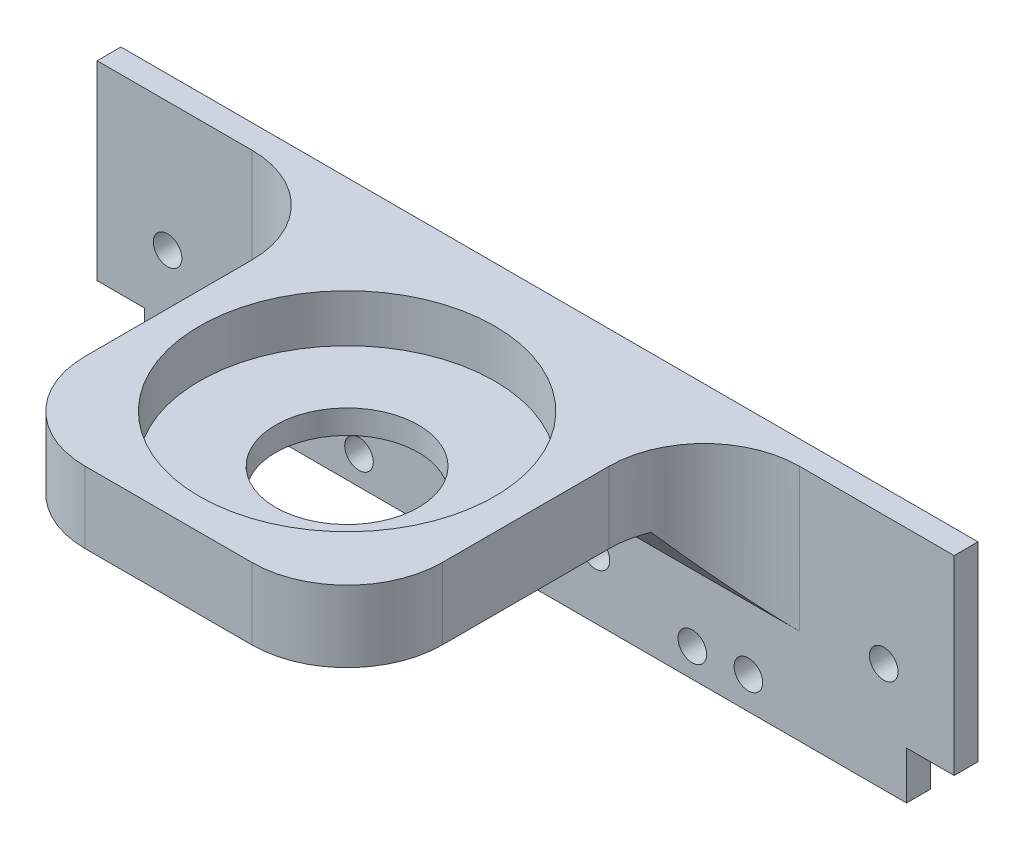
from build123d import *

# Parameters (mm, degrees)
ESQUISSE1_W             = 180
ESQUISSE1_H             = 50
ESQUISSE1_R             = 3
BOSS_EXTRU_1_DEPTH      = 5
ESQUISSE2_W             = 75
ESQUISSE2_H             = 15
BOSS_EXTRU_2_DEPTH      = 75
ESQUISSE3_R             = 15
ENL_V_MAT_EXTRU_1_DEPTH = 15
ESQUISSE4_R             = 31
ENL_V_MAT_EXTRU_2_DEPTH = 10
CONG_1_R                = 20
CHANFREIN1_SIZE         = 15
CHANFREIN1_SIZE2        = 12.586494468
CONG_2_R                = 20
ESQUISSE5_W             = 10
ESQUISSE5_H             = 10
ENL_V_MAT_EXTRU_3_DEPTH = 5


with BuildPart() as part:
    # Esquisse1 → Boss.-Extru.1 (new body)
    with BuildSketch(Plane.XY):
        with Locations((5.796013405, 25)):
            Rectangle(ESQUISSE1_W, ESQUISSE1_H)
        with Locations((40.796013405, 6)):
            Circle(ESQUISSE1_R, mode=Mode.SUBTRACT)
        with Locations((-69.406004871, 22.939397164)):
            Circle(ESQUISSE1_R, mode=Mode.SUBTRACT)
        with Locations((-40.981469067, 6.77616521)):
            Circle(ESQUISSE1_R, mode=Mode.SUBTRACT)
        with Locations((-8.861542866, 12.901085106)):
            Circle(ESQUISSE1_R, mode=Mode.SUBTRACT)
        with Locations(Location((-29.203986595, 6, 0), (0, 0, 180))):
            Circle(ESQUISSE1_R, mode=Mode.SUBTRACT)
        with Locations(Location((80.99803168, 22.939397164, 0), (0, 0, 180))):
            Circle(ESQUISSE1_R, mode=Mode.SUBTRACT)
        with Locations(Location((52.573495876, 6.77616521, 0), (0, 0, 180))):
            Circle(ESQUISSE1_R, mode=Mode.SUBTRACT)
        with Locations(Location((20.453569676, 12.901085106, 0), (0, 0, 180))):
            Circle(ESQUISSE1_R, mode=Mode.SUBTRACT)
    extrude(amount=BOSS_EXTRU_1_DEPTH)

    # Esquisse2 → Boss.-Extru.2 (add)
    with BuildSketch(Plane.XY.offset(5)):
        with Locations((5.796013405, 42.5)):
            Rectangle(ESQUISSE2_W, ESQUISSE2_H)
    extrude(amount=BOSS_EXTRU_2_DEPTH)

    # Esquisse3 → Enlèv. mat.-Extru.1 (cut)
    with BuildSketch(Plane(origin=(0, 50, 0), x_dir=(1, 0, 0), z_dir=(0, 1, 0))):
        with Locations(Location((5.796013405, -42.5, 0), (0, 0, 270))):
            Circle(ESQUISSE3_R)
    extrude(amount=-ENL_V_MAT_EXTRU_1_DEPTH, mode=Mode.SUBTRACT)

    # Esquisse4 → Enlèv. mat.-Extru.2 (cut)
    with BuildSketch(Plane(origin=(0, 50, 0), x_dir=(1, 0, 0), z_dir=(0, 1, 0))):
        with Locations(Location((5.796013405, -42.5, 0), (0, 0, 270))):
            Circle(ESQUISSE4_R)
    extrude(amount=-ENL_V_MAT_EXTRU_2_DEPTH, mode=Mode.SUBTRACT)

    # Congé1
    cong_1_edges = [part.edges().sort_by_distance(p)[0] for p in [
        (43.296013405, 42.5, 80),
        (-31.703986595, 42.5, 80),
    ]]
    fillet(cong_1_edges, radius=CONG_1_R)

    # Chanfrein1
    chanfrein1_edges = [part.edges().sort_by_distance(p)[0] for p in [
        (5.796013405, 35, 5),
    ]]
    chanfrein1_side = [part.faces().sort_by_distance(p)[0] for p in [
        (5.796013405, 22.805952806, 5),
    ]]
    chamfer(chanfrein1_edges, length=CHANFREIN1_SIZE, length2=CHANFREIN1_SIZE2, reference=chanfrein1_side[0])

    # Congé2
    # the kernel refuses this fillet: 20 mm, written as the material it adds along each edge
    with BuildSketch(Plane(origin=(-31.703986595, -30, 5), x_dir=(0, 0, 1), z_dir=(0, 1, 0))) as cong_2_piece_1_section:
        with BuildLine():
            CenterArc((CONG_2_R, -CONG_2_R), CONG_2_R, 90, 90)
            Line((0, -CONG_2_R), (0, 0))
            Line((0, 0), (CONG_2_R, 0))
        make_face()
    cong_2_piece_1 = extrude(amount=80, mode=Mode.PRIVATE)
    cong_2_piece_1 = split(cong_2_piece_1, bisect_by=Plane(origin=(-37.472324852, 26.525505275, 10.475549069), z_dir=(0, 0.6427876096865406, -0.766044443118977)), keep=Keep.TOP, mode=Mode.PRIVATE)
    cong_2_piece_1 = split(cong_2_piece_1, bisect_by=Plane(origin=(-37.472324852, 35, 7.522714945), z_dir=(0, -1, 0)), keep=Keep.TOP, mode=Mode.PRIVATE)
    add(cong_2_piece_1)
    with BuildSketch(Plane(origin=(-31.703986595, -30, 5), x_dir=(0, 0, 1), z_dir=(0, 1, 0))) as cong_2_piece_2_section:
        with BuildLine():
            CenterArc((CONG_2_R, -CONG_2_R), CONG_2_R, 90, 90)
            Line((0, -CONG_2_R), (0, 0))
            Line((0, 0), (CONG_2_R, 0))
        make_face()
    cong_2_piece_2 = extrude(amount=80, mode=Mode.PRIVATE)
    cong_2_piece_2 = split(cong_2_piece_2, bisect_by=Plane(origin=(-31.680860217, 38.546515029, 20.562373921), z_dir=(0, -0.6427876096865406, 0.766044443118977)), keep=Keep.TOP, mode=Mode.PRIVATE)
    cong_2_piece_2 = split(cong_2_piece_2, bisect_by=Plane(origin=(-31.680860217, 35, 21.798113742), z_dir=(0, 1, 0)), keep=Keep.TOP, mode=Mode.PRIVATE)
    add(cong_2_piece_2)
    with BuildSketch(Plane(origin=(-31.703986595, -30, 5), x_dir=(0, 0, 1), z_dir=(0, 1, 0))) as cong_2_piece_3_section:
        with BuildLine():
            CenterArc((CONG_2_R, -CONG_2_R), CONG_2_R, 90, 90)
            Line((0, -CONG_2_R), (0, 0))
            Line((0, 0), (CONG_2_R, 0))
        make_face()
    cong_2_piece_3 = extrude(amount=80, mode=Mode.PRIVATE)
    cong_2_piece_3 = split(cong_2_piece_3, bisect_by=Plane(origin=(-36.294325359, 35.39038505, 17.914066419), z_dir=(0, 0.6427876096865406, -0.766044443118977)), keep=Keep.TOP, mode=Mode.PRIVATE)
    cong_2_piece_3 = split(cong_2_piece_3, bisect_by=Plane(origin=(-36.294325359, 35, 9.359564784), z_dir=(0, 1, 0)), keep=Keep.TOP, mode=Mode.PRIVATE)
    add(cong_2_piece_3)
    with BuildSketch(Plane(origin=(43.296013405, -30, 5), x_dir=(0, 0, 1), z_dir=(0, 1, 0))) as cong_2_piece_4_section:
        with BuildLine():
            CenterArc((CONG_2_R, CONG_2_R), CONG_2_R, 180, 90)
            Line((0, CONG_2_R), (0, 0))
            Line((0, 0), (CONG_2_R, 0))
        make_face()
    cong_2_piece_4 = extrude(amount=80, mode=Mode.PRIVATE)
    cong_2_piece_4 = split(cong_2_piece_4, bisect_by=Plane(origin=(49.064351662, 35, 7.522714945), z_dir=(0, -1, 0)), keep=Keep.TOP, mode=Mode.PRIVATE)
    cong_2_piece_4 = split(cong_2_piece_4, bisect_by=Plane(origin=(49.064351662, 26.525505275, 10.475549069), z_dir=(0, 0.6427876096865406, -0.766044443118977)), keep=Keep.TOP, mode=Mode.PRIVATE)
    add(cong_2_piece_4)
    with BuildSketch(Plane(origin=(43.296013405, -30, 5), x_dir=(0, 0, 1), z_dir=(0, 1, 0))) as cong_2_piece_5_section:
        with BuildLine():
            CenterArc((CONG_2_R, CONG_2_R), CONG_2_R, 180, 90)
            Line((0, CONG_2_R), (0, 0))
            Line((0, 0), (CONG_2_R, 0))
        make_face()
    cong_2_piece_5 = extrude(amount=80, mode=Mode.PRIVATE)
    cong_2_piece_5 = split(cong_2_piece_5, bisect_by=Plane(origin=(43.272887026, 35, 21.798113742), z_dir=(0, 1, 0)), keep=Keep.TOP, mode=Mode.PRIVATE)
    cong_2_piece_5 = split(cong_2_piece_5, bisect_by=Plane(origin=(43.272887026, 38.546515029, 20.562373921), z_dir=(0, -0.6427876096865406, 0.766044443118977)), keep=Keep.TOP, mode=Mode.PRIVATE)
    add(cong_2_piece_5)
    with BuildSketch(Plane(origin=(43.296013405, -30, 5), x_dir=(0, 0, 1), z_dir=(0, 1, 0))) as cong_2_piece_6_section:
        with BuildLine():
            CenterArc((CONG_2_R, CONG_2_R), CONG_2_R, 180, 90)
            Line((0, CONG_2_R), (0, 0))
            Line((0, 0), (CONG_2_R, 0))
        make_face()
    cong_2_piece_6 = extrude(amount=80, mode=Mode.PRIVATE)
    cong_2_piece_6 = split(cong_2_piece_6, bisect_by=Plane(origin=(47.886352168, 35, 9.359564784), z_dir=(0, 1, 0)), keep=Keep.TOP, mode=Mode.PRIVATE)
    cong_2_piece_6 = split(cong_2_piece_6, bisect_by=Plane(origin=(47.886352168, 35.39038505, 17.914066419), z_dir=(0, 0.6427876096865406, -0.766044443118977)), keep=Keep.TOP, mode=Mode.PRIVATE)
    add(cong_2_piece_6)

    # Esquisse5 → Enlèv. mat.-Extru.3 (cut)
    with BuildSketch(Plane.XY.offset(5)):
        with Locations((-79.203986595, 5)):
            Rectangle(ESQUISSE5_W, ESQUISSE5_H)
        with Locations((90.796013405, 5)):
            Rectangle(ESQUISSE5_W, ESQUISSE5_H)
    extrude(amount=-ENL_V_MAT_EXTRU_3_DEPTH, mode=Mode.SUBTRACT)


solid = part.part
